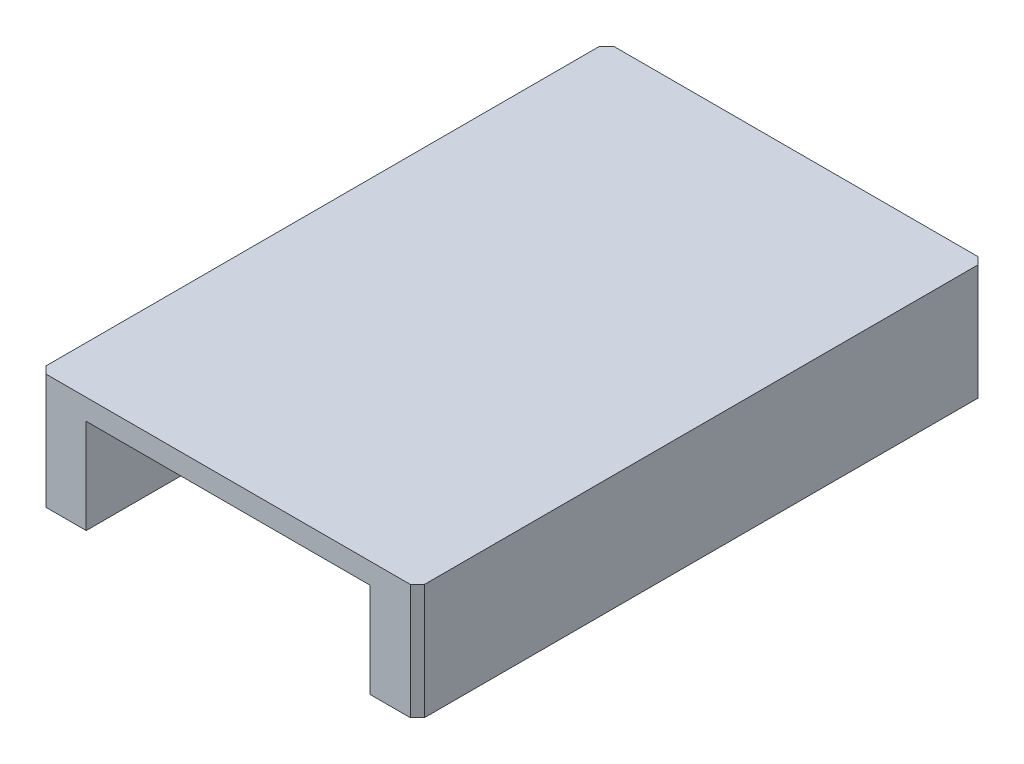
from build123d import *

# Parameters (mm, degrees)
SCHIZZO1_W                        = 60
SCHIZZO1_H                        = 7.2
SCHIZZO1_W_2                      = 19.125
SCHIZZO1_H_2                      = 5
ESTRUSIONE_ESTRUSIONE1_DEPTH      = 40
SCHIZZO2_W                        = 11.375
SCHIZZO2_H                        = 5
SCHIZZO2_W_2                      = 2.075
SCHIZZO2_H_2                      = 1.1
SCHIZZO2_W_3                      = 2.05
TAGLIO_ESTRUSIONE1_DEPTH          = 73.469579825
SMUSSO1_SIZE                      = 0.75
SCHIZZO3_W                        = 7.25
SCHIZZO3_H                        = 5
TAGLIO_ESTRUSIONE2_DEPTH          = 64
SCHIZZO4_W                        = 38.5
SCHIZZO4_H                        = 1.1
ESTRUSIONE_ESTRUSIONE3_DEPTH      = 60
SCHIZZO7_W                        = 30
SCHIZZO7_H                        = 1.1
ESTRUSIONE_ESTRUSIONE4_DEPTH      = 50
ESTRUSIONE_ESTRUSIONE5_DEPTH      = 5
ESTRUSIONE_ESTRUSIONE6_DEPTH      = 5
ESTRUSIONE_ESTRUSIONE6_DEPTH_BACK = 35
SCHIZZO9_W                        = 19.125
SCHIZZO9_H                        = 1.1
SCHIZZO10_W                       = 19.125
SCHIZZO10_H                       = 3.9
TAGLIO_ESTRUSIONE3_DEPTH          = 73.469579825
SCHIZZO11_W                       = 19.125
SCHIZZO11_H                       = 7.8
ESTRUSIONE_ESTRUSIONE7_DEPTH      = 40
SCHIZZO12_W                       = 30
SCHIZZO12_H                       = 10
TAGLIO_ESTRUSIONE4_DEPTH          = 64


with BuildPart() as part:
    # Schizzo1 → Estrusione-Estrusione1 (new body)
    with BuildSketch(Plane(origin=(0, 0, 0), x_dir=(0, 0, -1), z_dir=(1, 0, 0))):
        with Locations((30, 3.6)):
            Rectangle(SCHIZZO1_W, SCHIZZO1_H)
        with Locations((43.1875, 3.6)):
            Rectangle(SCHIZZO1_W_2, SCHIZZO1_H_2, mode=Mode.SUBTRACT)
        with Locations((16.8125, 3.6)):
            Rectangle(SCHIZZO1_W_2, SCHIZZO1_H_2, mode=Mode.SUBTRACT)
    extrude(amount=ESTRUSIONE_ESTRUSIONE1_DEPTH)

    # Schizzo2 → Taglio-Estrusione1 (cut, through all)
    with BuildSketch(Plane.XY):
        with Locations((10.6875, 2.5)):
            Rectangle(SCHIZZO2_W, SCHIZZO2_H)
        with Locations((29.3125, 2.5)):
            Rectangle(SCHIZZO2_W, SCHIZZO2_H)
        with Locations((15.3375, 6.65)):
            Rectangle(SCHIZZO2_W_2, SCHIZZO2_H_2)
        with Locations((8.275, 6.65)):
            Rectangle(SCHIZZO2_W_3, SCHIZZO2_H_2)
        with Locations((24.6625, 6.65)):
            Rectangle(SCHIZZO2_W_2, SCHIZZO2_H_2)
        with Locations((31.725, 6.65)):
            Rectangle(SCHIZZO2_W_3, SCHIZZO2_H_2)
    extrude(amount=-TAGLIO_ESTRUSIONE1_DEPTH, mode=Mode.SUBTRACT)

    # Smusso1
    smusso1_edges = [part.edges().sort_by_distance(p)[0] for p in [
        (0, 3.6, -60),
        (40, 3.6, -60),
        (40, 3.6, 0),
        (0, 3.6, 0),
    ]]
    chamfer(smusso1_edges, length=SMUSSO1_SIZE)

    # Schizzo3 → Taglio-Estrusione2 (cut)
    with BuildSketch(Plane.XY):
        with Locations((20, 2.5)):
            Rectangle(SCHIZZO3_W, SCHIZZO3_H)
    extrude(amount=-TAGLIO_ESTRUSIONE2_DEPTH, mode=Mode.SUBTRACT)

    # Schizzo4 → Estrusione-Estrusione3 (add)
    with BuildSketch(Plane.XY):
        with Locations((20, 6.65)):
            Rectangle(SCHIZZO4_W, SCHIZZO4_H)
    extrude(amount=-ESTRUSIONE_ESTRUSIONE3_DEPTH)

    # Schizzo7 → Estrusione-Estrusione4 (add)
    with BuildSketch(Plane.XY.offset(-52.75)):
        with Locations((20, 5.55)):
            Rectangle(SCHIZZO7_W, SCHIZZO7_H)
    extrude(amount=ESTRUSIONE_ESTRUSIONE4_DEPTH)

    # Schizzo8 → Estrusione-Estrusione5 (add)
    with BuildSketch(Plane.XZ):
        Polygon((5, 0), (0.75, 0), (0, -0.75), (0, -59.25), (0.75, -60), (5, -60), align=None)
        Polygon((35, 0), (35, -60), (39.25, -60), (40, -59.25), (40, -0.75), (39.25, 0), align=None)
    extrude(amount=ESTRUSIONE_ESTRUSIONE5_DEPTH)

    # Schizzo9 → Estrusione-Estrusione6 (add, two sides: drawn at the far end of the back side and taken through both)
    with BuildSketch(Plane(origin=(35, 0, 0), x_dir=(0, 0, -1), z_dir=(1, 0, 0)).offset(-ESTRUSIONE_ESTRUSIONE6_DEPTH_BACK)):
        with Locations((16.8125, 5.55)):
            Rectangle(SCHIZZO9_W, SCHIZZO9_H)
        with Locations((43.1875, 5.55)):
            Rectangle(SCHIZZO9_W, SCHIZZO9_H)
    extrude(amount=ESTRUSIONE_ESTRUSIONE6_DEPTH + ESTRUSIONE_ESTRUSIONE6_DEPTH_BACK)

    # Schizzo10 → Taglio-Estrusione3 (cut, through all)
    with BuildSketch(Plane.ZY):
        with Locations((-43.1875, -0.85)):
            Rectangle(SCHIZZO10_W, SCHIZZO10_H)
        with Locations((-16.8125, -0.85)):
            Rectangle(SCHIZZO10_W, SCHIZZO10_H)
    extrude(amount=-TAGLIO_ESTRUSIONE3_DEPTH, mode=Mode.SUBTRACT)

    # Schizzo11 → Estrusione-Estrusione7 (add)
    with BuildSketch(Plane.ZY):
        with Locations((-43.1875, 1.1)):
            Rectangle(SCHIZZO11_W, SCHIZZO11_H)
        with Locations((-16.8125, 1.1)):
            Rectangle(SCHIZZO11_W, SCHIZZO11_H)
    extrude(amount=-ESTRUSIONE_ESTRUSIONE7_DEPTH)

    # Schizzo12 → Taglio-Estrusione4 (cut)
    with BuildSketch(Plane(origin=(0, 0, -60), x_dir=(-1, 0, 0), z_dir=(0, 0, -1))):
        with Locations((-20, 0)):
            Rectangle(SCHIZZO12_W, SCHIZZO12_H)
    extrude(amount=-TAGLIO_ESTRUSIONE4_DEPTH, mode=Mode.SUBTRACT)


solid = part.part
